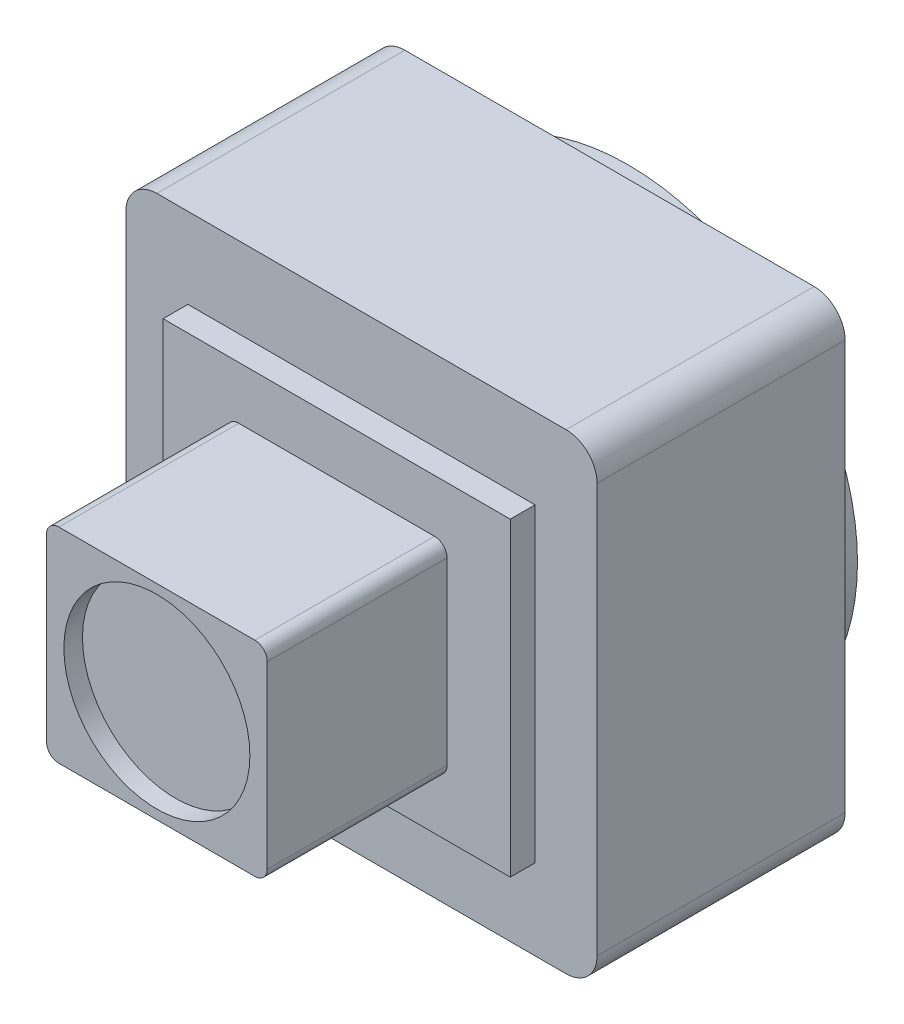
from build123d import *

# Parameters (mm, degrees)
SKETCH1_W           = 96.52
SKETCH1_H           = 96.52
BOSS_EXTRUDE1_DEPTH = 50.8
SKETCH2_W           = 71.12
SKETCH2_H           = 63.5
BOSS_EXTRUDE2_DEPTH = 5.08
SKETCH3_W           = 45.212
SKETCH3_H           = 41.91
BOSS_EXTRUDE3_DEPTH = 36.83
SKETCH4_R           = 19.05
CUT_EXTRUDE1_DEPTH  = 3.81
SKETCH5_R           = 46.99
BOSS_EXTRUDE4_DEPTH = 3.81
FILLET1_R           = 2.54
FILLET2_R           = 6.35


with BuildPart() as part:
    # Sketch1 → Boss-Extrude1 (new body)
    with BuildSketch(Plane.XY):
        Rectangle(SKETCH1_W, SKETCH1_H)
    extrude(amount=BOSS_EXTRUDE1_DEPTH)

    # Sketch2 → Boss-Extrude2 (add)
    with BuildSketch(Plane.XY.offset(50.8)):
        Rectangle(SKETCH2_W, SKETCH2_H)
    extrude(amount=BOSS_EXTRUDE2_DEPTH)

    # Sketch3 → Boss-Extrude3 (add)
    with BuildSketch(Plane.XY.offset(55.88)):
        Rectangle(SKETCH3_W, SKETCH3_H)
    extrude(amount=BOSS_EXTRUDE3_DEPTH)

    # Sketch4 → Cut-Extrude1 (cut)
    with BuildSketch(Plane.XY.offset(92.71)):
        Circle(SKETCH4_R)
    extrude(amount=-CUT_EXTRUDE1_DEPTH, mode=Mode.SUBTRACT)

    # Sketch5 → Boss-Extrude4 (add)
    with BuildSketch(Plane(origin=(0, 0, 0), x_dir=(-1, 0, 0), z_dir=(0, 0, -1))):
        Circle(SKETCH5_R)
    extrude(amount=BOSS_EXTRUDE4_DEPTH)

    # Fillet1
    fillet1_edges = [part.edges().sort_by_distance(p)[0] for p in [
        (-22.606, -20.955, 74.295),
        (-22.606, 20.955, 74.295),
        (22.606, -20.955, 74.295),
        (22.606, 20.955, 74.295),
    ]]
    fillet(fillet1_edges, radius=FILLET1_R)

    # Fillet2
    fillet2_edges = [part.edges().sort_by_distance(p)[0] for p in [
        (48.26, 48.26, 25.4),
        (48.26, -48.26, 25.4),
        (-48.26, -48.26, 25.4),
        (-48.26, 48.26, 25.4),
    ]]
    fillet(fillet2_edges, radius=FILLET2_R)


solid = part.part
